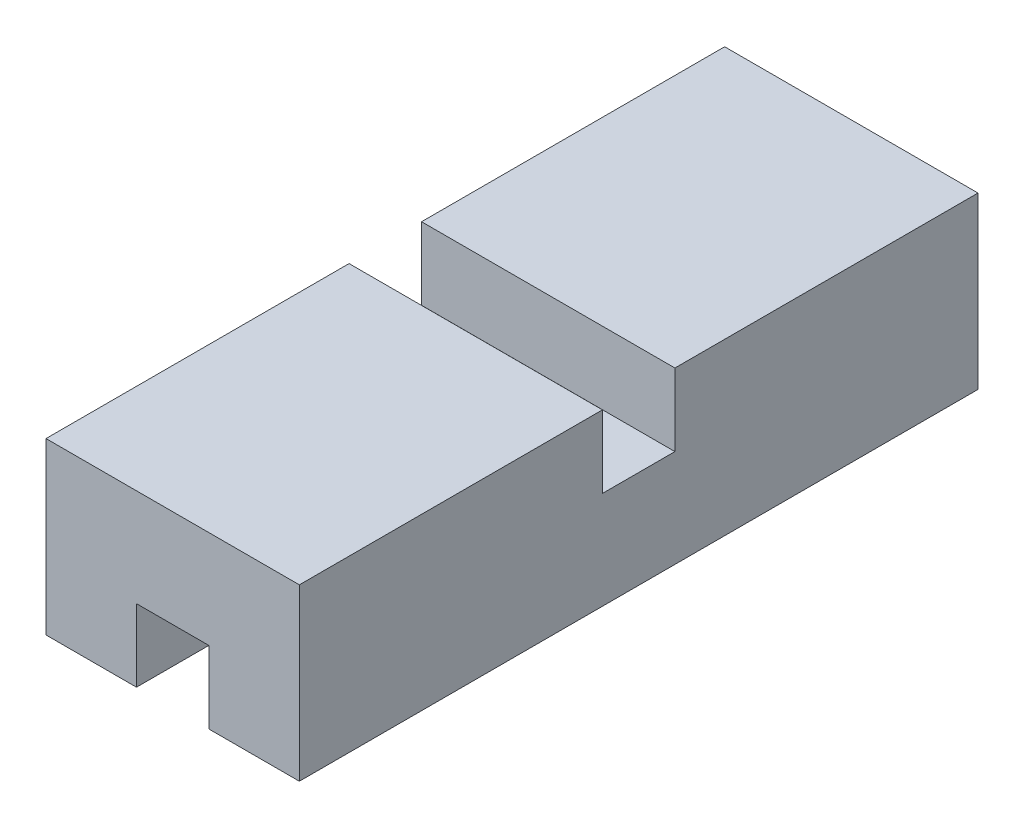
from build123d import *

# Parameters (mm, degrees)
SKETCH1_W           = 28
SKETCH1_H           = 75
BOSS_EXTRUDE1_DEPTH = 2.8
SKETCH2_W           = 28
SKETCH2_H           = 33.495
BOSS_EXTRUDE2_DEPTH = 8
SKETCH3_W           = 10
SKETCH3_H           = 75
BOSS_EXTRUDE3_DEPTH = 8


with BuildPart() as part:
    # Sketch1 → Boss-Extrude1 (new body)
    with BuildSketch(Plane(origin=(0, 0, 0), x_dir=(1, 0, 0), z_dir=(0, 1, 0))):
        with Locations((14, 37.5)):
            Rectangle(SKETCH1_W, SKETCH1_H)
    extrude(amount=BOSS_EXTRUDE1_DEPTH)

    # Sketch2 → Boss-Extrude2 (add)
    with BuildSketch(Plane(origin=(0, 2.8, 0), x_dir=(1, 0, 0), z_dir=(0, 1, 0))):
        with Locations((14, 16.7475)):
            Rectangle(SKETCH2_W, SKETCH2_H)
        with Locations((14, 58.2525)):
            Rectangle(SKETCH2_W, SKETCH2_H)
    extrude(amount=BOSS_EXTRUDE2_DEPTH)

    # Sketch3 → Boss-Extrude3 (add)
    with BuildSketch(Plane.XZ):
        with Locations((5, -37.5)):
            Rectangle(SKETCH3_W, SKETCH3_H)
        with Locations((23, -37.5)):
            Rectangle(SKETCH3_W, SKETCH3_H)
    extrude(amount=BOSS_EXTRUDE3_DEPTH)


solid = part.part
